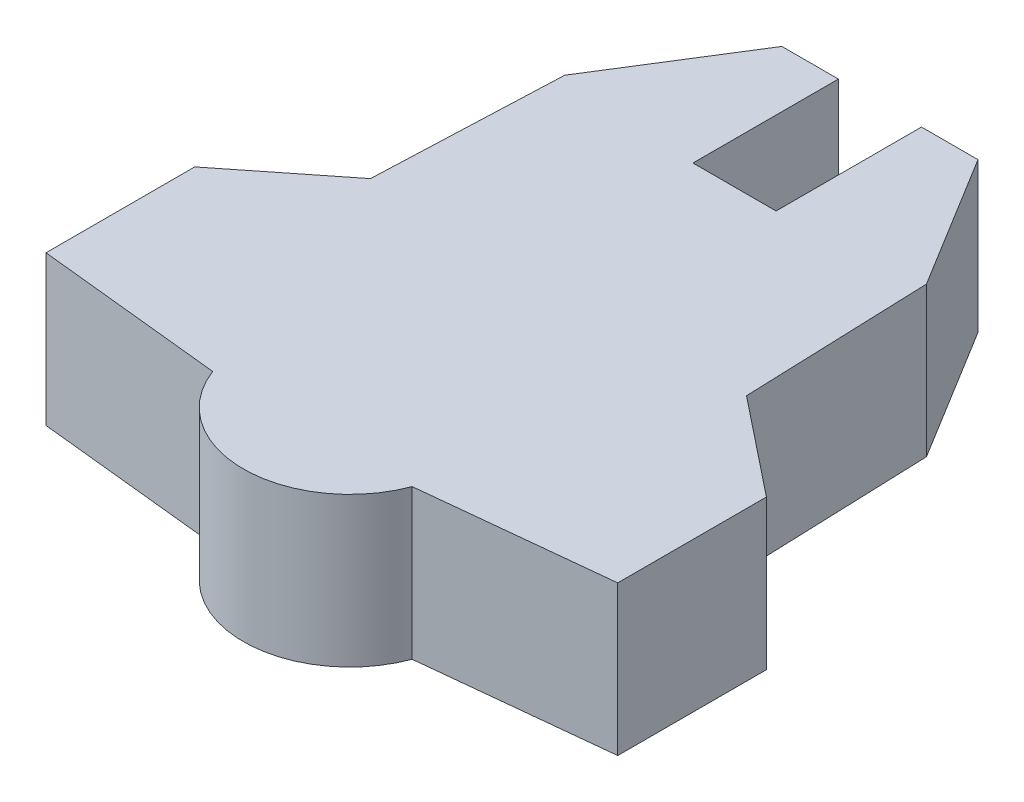
from build123d import *

# Parameters (mm, degrees)
BOSS_EXTRUDE1_DEPTH = 9
SKETCH3_R           = 2.5
BOSS_EXTRUDE2_DEPTH = 6


with BuildPart() as part:
    # Sketch2 → Boss-Extrude1 (new body)
    with BuildSketch(Plane(origin=(0, 0, 0), x_dir=(1, 0, 0), z_dir=(0, 1, 0))):
        with BuildLine():
            Line((21.423631539, 59.756571467), (21.423631539, 67.28012571))
            Line((21.423631539, 67.28012571), (27.320471351, 71.956929699))
            Line((27.320471351, 71.956929699), (27.777984785, 83.191426238))
            Line((27.777984785, 83.191426238), (32.810632556, 91.223328742))
            Line((32.810632556, 91.223328742), (36.210632556, 91.223328742))
            Line((36.210632556, 91.223328742), (36.210632556, 82.473328742))
            Line((36.210632556, 82.473328742), (41.210632556, 82.473328742))
            Line((41.210632556, 82.473328742), (41.210632556, 91.223328742))
            Line((41.210632556, 91.223328742), (44.610632556, 91.223328742))
            Line((44.610632556, 91.223328742), (49.541610675, 83.191426238))
            Line((49.541610675, 83.191426238), (49.948289283, 71.956929699))
            Line((49.948289283, 71.956929699), (55.823631539, 67.28012571))
            Line((55.823631539, 67.28012571), (55.823631539, 58.333196339))
            Line((55.823631539, 58.333196339), (44.623631539, 57.163995342))
            ThreePointArc((44.623631539, 57.163995342), (38.623631539, 53.004094152), (32.623631539, 57.163995342))
            Line((32.623631539, 57.163995342), (21.423631539, 58.333196339))
            Line((21.423631539, 58.333196339), (21.423631539, 59.756571467))
        make_face()
    extrude(amount=BOSS_EXTRUDE1_DEPTH)

    # Sketch3 → Boss-Extrude2 (add)
    with BuildSketch(Plane.XZ):
        with Locations((38.670089984, -68.740632333)):
            Circle(SKETCH3_R)
    extrude(amount=BOSS_EXTRUDE2_DEPTH)


solid = part.part
